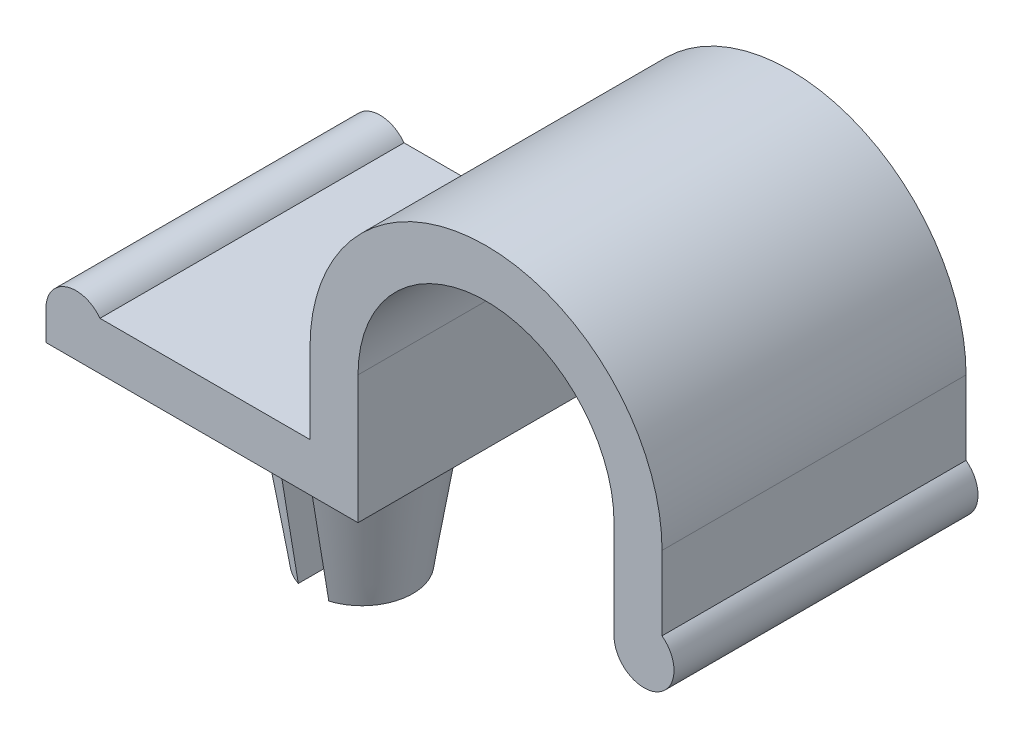
from build123d import *

# Parameters (mm, degrees)
BASE_EXTRUDE_DEPTH      = 3.8
CUT_EXTRUDE1_DEPTH      = 15.038454366
CUT_EXTRUDE1_DEPTH_BACK = 15.038454366


with BuildPart() as part:
    # Sketch1 → Base-Extrude (new, symmetric)
    with BuildSketch(Plane.XY):
        with BuildLine():
            Line((-9.65, -2), (-4.4, -2))
            Line((-4.4, -2), (-4.4, 0))
            ThreePointArc((-4.4, 0), (0, 4.4), (4.4, 0))
            Line((4.4, 0), (4.4, -1.85))
            ThreePointArc((4.4, -1.85), (4.285410197, -3.120820393), (3.2, -2.45))
            Line((3.2, -2.45), (3.2, 0))
            ThreePointArc((3.2, 0), (0, 3.2), (-3.2, 0))
            Line((-3.2, 0), (-3.2, -3.2))
            Line((-3.2, -3.2), (-11, -3.2))
            Line((-11, -3.2), (-11, -2.45))
            ThreePointArc((-11, -2.45), (-10.487170825, -1.738487526), (-9.65, -2))
        make_face()
    extrude(amount=BASE_EXTRUDE_DEPTH, both=True)

    # Sketch4 → Boss-Revolve1 (revolve)
    with BuildSketch(Plane.XY):
        Polygon((-6.9, -3.2), (-6.9, -7.851), (-5.63, -7.851), (-5.15, -4.851), (-5.4, -4.851), (-5.4, -3.2), align=None)
    revolve(axis=Axis((-6.9, -3.2, 0), (0, 1, 0)))

    # Sketch5 → Cut-Extrude1 (cut, two sides: drawn at the far end of the back side and taken through both)
    with BuildSketch(Plane.XY.offset(-CUT_EXTRUDE1_DEPTH_BACK)):
        with BuildLine():
            Line((-7.281, -7.851), (-6.519, -7.851))
            Line((-6.519, -7.851), (-6.519, -3.787))
            ThreePointArc((-6.519, -3.787), (-6.9, -3.406), (-7.281, -3.787))
            Line((-7.281, -3.787), (-7.281, -7.851))
        make_face()
    extrude(amount=CUT_EXTRUDE1_DEPTH + CUT_EXTRUDE1_DEPTH_BACK, mode=Mode.SUBTRACT)


solid = part.part
